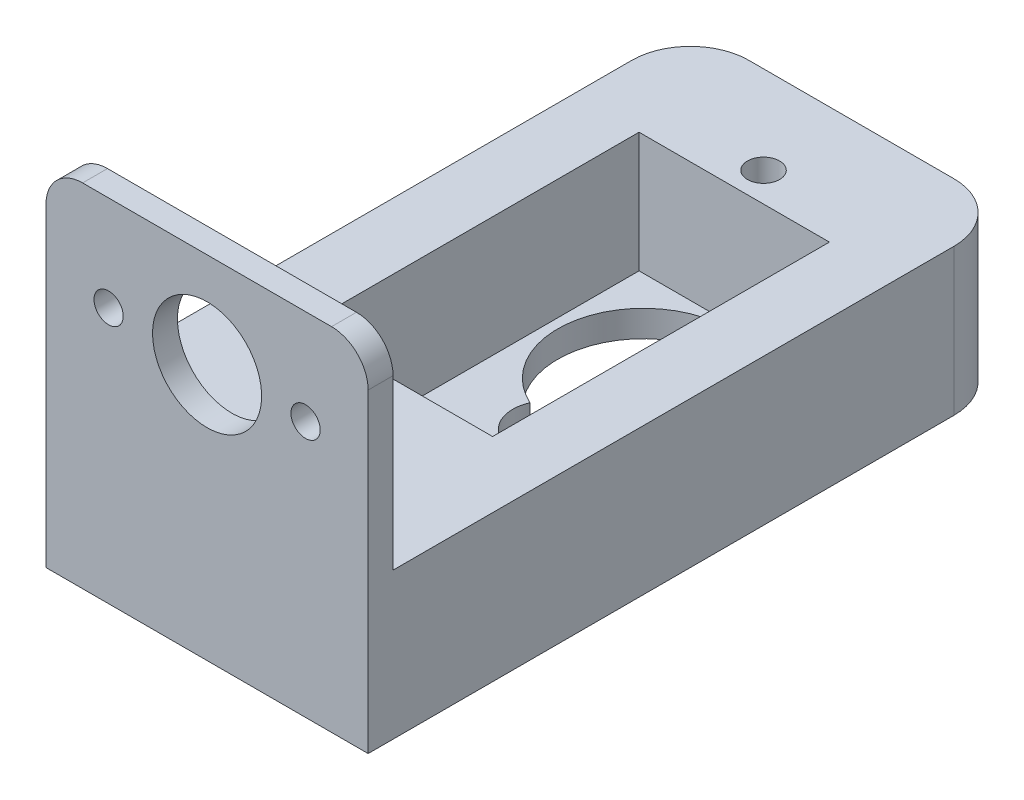
from build123d import *

# Parameters (mm, degrees)
SKETCH1_W           = 22
SKETCH1_H           = 44
BOSS_EXTRUDE1_DEPTH = 10
SKETCH2_W           = 13
SKETCH2_H           = 23
CUT_EXTRUDE1_DEPTH  = 8.2
SKETCH3_R           = 5.85
CUT_EXTRUDE2_DEPTH  = 50.872236766
SKETCH4_W           = 22
SKETCH4_H           = 1.7
BOSS_EXTRUDE2_DEPTH = 14
SKETCH5_R           = 3.725
CUT_EXTRUDE3_DEPTH  = 54.378741087
SKETCH5_3_R         = 3.725
SKETCH5_3_R_2       = 1
CUT_EXTRUDE4_DEPTH  = 10
SKETCH6_R           = 1.1
CUT_EXTRUDE5_DEPTH  = 4
FILLET1_R           = 4
FILLET2_R           = 2.5
CUT_EXTRUDE6_DEPTH  = 10


with BuildPart() as part:
    # Sketch1 → Boss-Extrude1 (new body)
    with BuildSketch(Plane(origin=(0, 0, 0), x_dir=(1, 0, 0), z_dir=(0, 1, 0))):
        with Locations((11, 22)):
            Rectangle(SKETCH1_W, SKETCH1_H)
    extrude(amount=BOSS_EXTRUDE1_DEPTH)

    # Sketch2 → Cut-Extrude1 (cut)
    with BuildSketch(Plane(origin=(0, 10, 0), x_dir=(1, 0, 0), z_dir=(0, 1, 0))):
        with Locations((11, 24.5)):
            Rectangle(SKETCH2_W, SKETCH2_H)
    extrude(amount=-CUT_EXTRUDE1_DEPTH, mode=Mode.SUBTRACT)

    # Sketch3 → Cut-Extrude2 (cut, through all)
    with BuildSketch(Plane(origin=(0, 1.8, 0), x_dir=(1, 0, 0), z_dir=(0, 1, 0))):
        with Locations((11, 29.8)):
            Circle(SKETCH3_R)
    extrude(amount=-CUT_EXTRUDE2_DEPTH, mode=Mode.SUBTRACT)

    # Sketch4 → Boss-Extrude2 (add)
    with BuildSketch(Plane(origin=(0, 10, 0), x_dir=(1, 0, 0), z_dir=(0, 1, 0))):
        with Locations((11, 0.85)):
            Rectangle(SKETCH4_W, SKETCH4_H)
    extrude(amount=BOSS_EXTRUDE2_DEPTH)

    # Sketch5 → Cut-Extrude3 (cut, through all)
    with BuildSketch(Plane(origin=(0, 0, -1.7), x_dir=(-1, 0, 0), z_dir=(0, 0, -1))):
        with Locations((-11, 17.5)):
            Circle(SKETCH5_R)
    extrude(amount=-CUT_EXTRUDE3_DEPTH, mode=Mode.SUBTRACT)

    # Sketch5<3> → Cut-Extrude4 (cut)
    with BuildSketch(Plane(origin=(0, 0, -1.7), x_dir=(-1, 0, 0), z_dir=(0, 0, -1))):
        with Locations((-11, 17.5)):
            Circle(SKETCH5_3_R)
        with Locations((-17.725, 17.5)):
            Circle(SKETCH5_3_R_2)
        with Locations((-4.275, 17.5)):
            Circle(SKETCH5_3_R_2)
    extrude(amount=-CUT_EXTRUDE4_DEPTH, mode=Mode.SUBTRACT)

    # Sketch6 → Cut-Extrude5 (cut)
    with BuildSketch(Plane(origin=(0, 10, 0), x_dir=(1, 0, 0), z_dir=(0, 1, 0))):
        with Locations((11, 38)):
            Circle(SKETCH6_R)
        with Locations((11, 10)):
            Circle(SKETCH6_R)
    extrude(amount=-CUT_EXTRUDE5_DEPTH, mode=Mode.SUBTRACT)

    # Fillet1
    fillet1_edges = [part.edges().sort_by_distance(p)[0] for p in [
        (0, 5, -44),
        (22, 5, -44),
    ]]
    fillet(fillet1_edges, radius=FILLET1_R)

    # Fillet2
    fillet2_edges = [part.edges().sort_by_distance(p)[0] for p in [
        (0, 24, -0.85),
        (22, 24, -0.85),
    ]]
    fillet(fillet2_edges, radius=FILLET2_R)

    # Sketch7 → Cut-Extrude6 (cut)
    with BuildSketch(Plane(origin=(0, 1.8, 0), x_dir=(1, 0, 0), z_dir=(0, 1, 0))):
        with BuildLine():
            ThreePointArc((8.573940242, 24.476774093), (10.770540976, 21.109848441), (12.967141709, 24.476774093))
            ThreePointArc((12.967141709, 24.476774093), (10.770540976, 24.047753407), (8.573940242, 24.476774093))
        make_face()
    extrude(amount=-CUT_EXTRUDE6_DEPTH, mode=Mode.SUBTRACT)


solid = part.part
